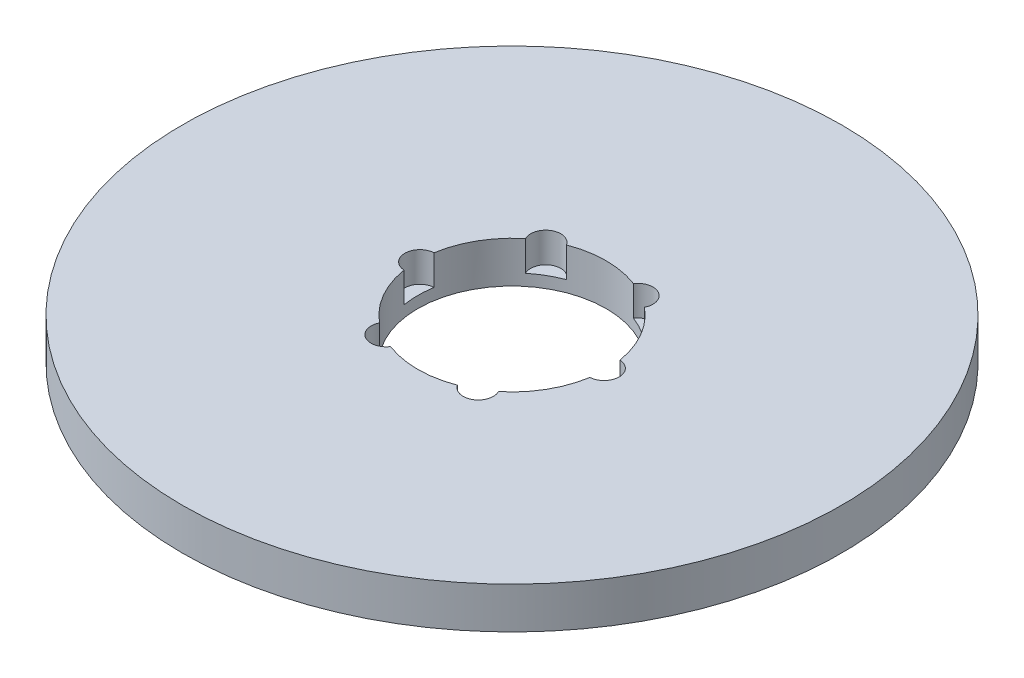
from build123d import *

# Parameters (mm, degrees)
SKETCH1_R           = 87.5
BOSS_EXTRUDE1_DEPTH = 11
SKETCH2_R           = 25
CUT_EXTRUDE1_DEPTH  = 125.231638482
SKETCH3_R           = 3.989527572
CUT_EXTRUDE2_DEPTH  = 7.969284113
CIRPATTERN1_COUNT   = 6


with BuildPart() as part:
    # Sketch1 → Boss-Extrude1 (new body)
    with BuildSketch(Plane(origin=(0, 0, 0), x_dir=(1, 0, 0), z_dir=(0, 1, 0))):
        Circle(SKETCH1_R)
    extrude(amount=BOSS_EXTRUDE1_DEPTH)

    # Sketch2 → Cut-Extrude1 (cut, through all)
    with BuildSketch(Plane(origin=(0, 0, 0), x_dir=(1, 0, 0), z_dir=(0, 1, 0))):
        Circle(SKETCH2_R)
    extrude(amount=CUT_EXTRUDE1_DEPTH, mode=Mode.SUBTRACT)

    # Sketch3 → Cut-Extrude2 (cut)
    with BuildSketch(Plane(origin=(0, 11, 0), x_dir=(1, 0, 0), z_dir=(0, 1, 0))):
        with Locations((-24.464974623, 0)):
            Circle(SKETCH3_R)
    cut_extrude2 = extrude(amount=-CUT_EXTRUDE2_DEPTH, mode=Mode.SUBTRACT)

    # CirPattern1: Cut-Extrude2 ×6 about axis
    cirpattern1_axis = Axis((0, 0, 0), (0, 1, 0))
    for i in range(1, CIRPATTERN1_COUNT):
        add(cut_extrude2.rotate(cirpattern1_axis, i * 360 / CIRPATTERN1_COUNT), mode=Mode.SUBTRACT)


solid = part.part
